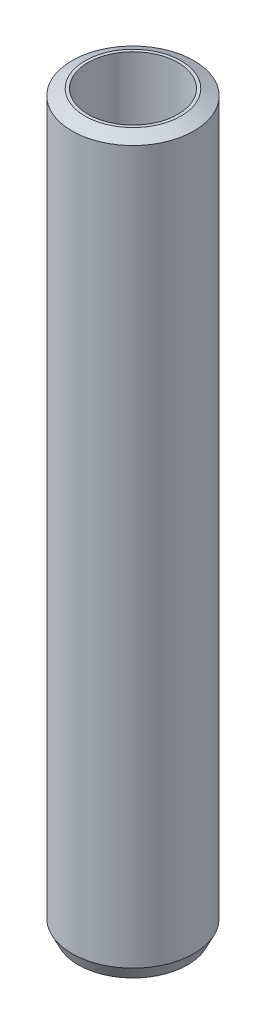
from build123d import *
from OCP.BRepFilletAPI import BRepFilletAPI_MakeChamfer

# Parameters (mm, degrees)
SKETCH1_R           = 50
BOSS_EXTRUDE1_DEPTH = 600
SKETCH2_R           = 36.850887273
CUT_EXTRUDE1_DEPTH  = 605.15229868
CHAMFER1_SIZE       = 5.231356553
CHAMFER1_SIZE2      = 10.676017235


with BuildPart() as part:
    # Sketch1 → Boss-Extrude1 (new body)
    with BuildSketch(Plane(origin=(0, 0, 0), x_dir=(1, 0, 0), z_dir=(0, 1, 0))):
        Circle(SKETCH1_R)
    extrude(amount=BOSS_EXTRUDE1_DEPTH)

    # Sketch2 → Cut-Extrude1 (cut, through all)
    with BuildSketch(Plane(origin=(0, 0, 0), x_dir=(1, 0, 0), z_dir=(0, 1, 0))):
        Circle(SKETCH2_R)
    extrude(amount=CUT_EXTRUDE1_DEPTH, mode=Mode.SUBTRACT)

    # Chamfer1: one chamfer whose edges measure the first distance from different faces: ONE call of the kernel's chamfer builder (chamfer() names one face for all edges)
    chamfer1_edges_1 = [part.edges().sort_by_distance(p)[0] for p in [
        (-50, 600, 0),
    ]]
    chamfer1_side_1 = [part.faces().sort_by_distance(p)[0] for p in [
        (-50, 300, 0),
    ]]
    chamfer1_edges_2 = [part.edges().sort_by_distance(p)[0] for p in [
        (-50, 0, 0),
    ]]
    chamfer1_side_2 = [part.faces().sort_by_distance(p)[0] for p in [
        (-48.585786438, 0, 0),
    ]]
    chamfer1 = BRepFilletAPI_MakeChamfer(part.part.solid().wrapped)
    for e in chamfer1_edges_1:
        chamfer1.Add(CHAMFER1_SIZE, CHAMFER1_SIZE2, e.wrapped, chamfer1_side_1[0].wrapped)  # the first distance lies on this face
    for e in chamfer1_edges_2:
        chamfer1.Add(CHAMFER1_SIZE, CHAMFER1_SIZE2, e.wrapped, chamfer1_side_2[0].wrapped)  # the first distance lies on this face
    add(Compound.cast(chamfer1.Shape()), mode=Mode.REPLACE)


solid = part.part
